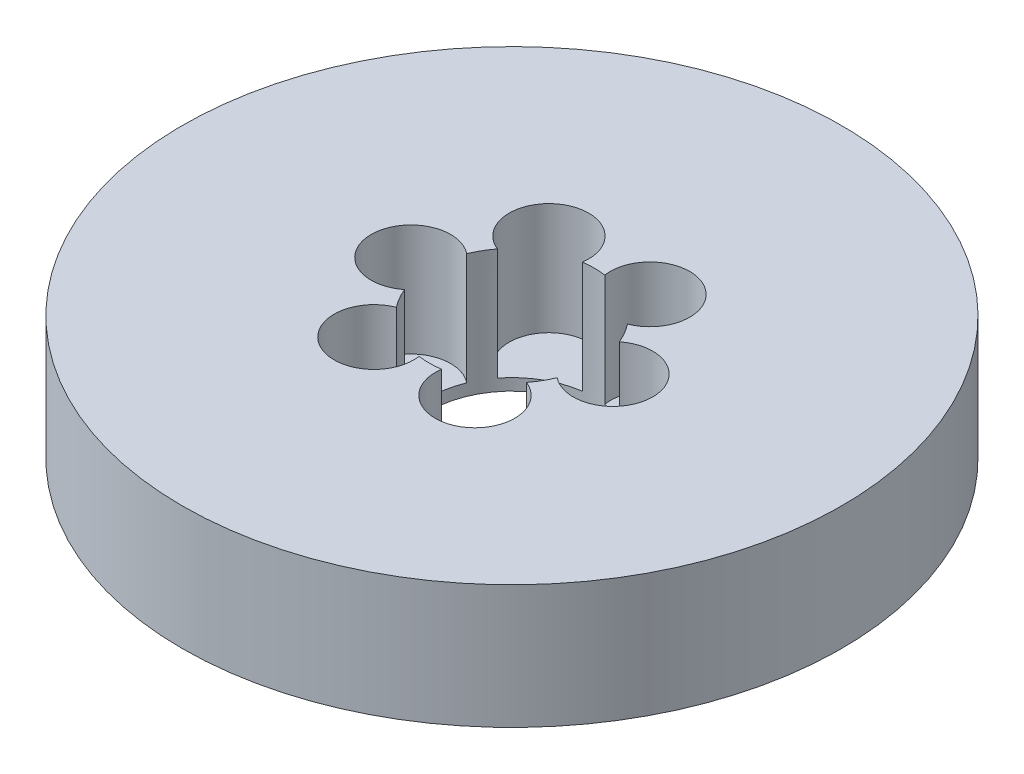
from build123d import *

# Parameters (mm, degrees)
SKETCH1_R           = 80
BOSS_EXTRUDE1_DEPTH = 30
SKETCH2_R           = 20
CUT_EXTRUDE1_DEPTH  = 118.046999107
SKETCH3_R           = 9.646342968
CUT_EXTRUDE2_DEPTH  = 27.144709159
CIRPATTERN1_COUNT   = 6


with BuildPart() as part:
    # Sketch1 → Boss-Extrude1 (new body)
    with BuildSketch(Plane(origin=(0, 0, 0), x_dir=(1, 0, 0), z_dir=(0, 1, 0))):
        Circle(SKETCH1_R)
    extrude(amount=BOSS_EXTRUDE1_DEPTH)

    # Sketch2 → Cut-Extrude1 (cut, through all)
    with BuildSketch(Plane(origin=(0, 0, 0), x_dir=(1, 0, 0), z_dir=(0, 1, 0))):
        Circle(SKETCH2_R)
    extrude(amount=CUT_EXTRUDE1_DEPTH, mode=Mode.SUBTRACT)

    # Sketch3 → Cut-Extrude2 (cut)
    with BuildSketch(Plane(origin=(0, 30, 0), x_dir=(1, 0, 0), z_dir=(0, 1, 0))):
        with Locations((-24.525659848, 0)):
            Circle(SKETCH3_R)
    cut_extrude2 = extrude(amount=-CUT_EXTRUDE2_DEPTH, mode=Mode.SUBTRACT)

    # CirPattern1: Cut-Extrude2 ×6 about axis
    cirpattern1_axis = Axis((0, 0, 0), (0, 1, 0))
    for i in range(1, CIRPATTERN1_COUNT):
        add(cut_extrude2.rotate(cirpattern1_axis, i * 360 / CIRPATTERN1_COUNT), mode=Mode.SUBTRACT)


solid = part.part
